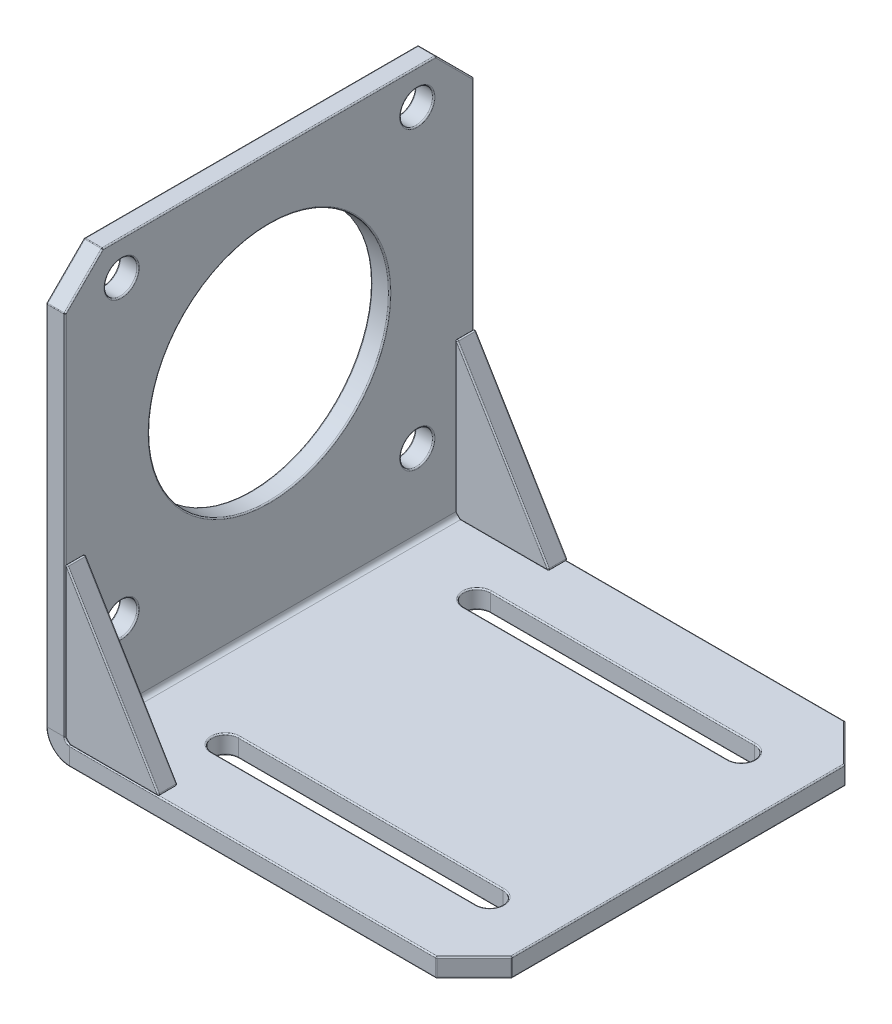
from build123d import *

# Parameters (mm, degrees)
SCHIZZO1_W                     = 68
SCHIZZO1_H                     = 3
BASE_FLANGIA1_DEPTH            = 32.5
BORDO_FLANGIA1_STRIP_W         = 13.4732
BORDO_FLANGIA1_STRIP_H         = 3
BORDO_FLANGIA1_STRIP_CUT_DEPTH = 65
BORDO_FLANGIA1_DEPTH           = 65
SCHIZZO10_R                    = 19.1
SCHIZZO10_R_2                  = 2.6
TAGLIO_ESTRUSIONE1_DEPTH       = 98.5
TAGLIO_ESTRUSIONE3_DEPTH       = 100.525122457
ESTRUSIONE_ESTRUSIONE3_START   = 32.5
ESTRUSIONE_ESTRUSIONE3_DEPTH   = 3
SMUSSO1_SIZE                   = 6
RACCORDO1_R                    = 0.2
RACCORDO2_R                    = 0.2
RACCORDO3_R                    = 0.2


# Sheet-metal steps are written as plain solids
with BuildPart() as part:
    # Schizzo1 → Base-Flangia1 (new, symmetric)
    with BuildSketch(Plane.XY):
        with Locations((34, -1.5)):
            Rectangle(SCHIZZO1_W, SCHIZZO1_H)
    extrude(amount=BASE_FLANGIA1_DEPTH, both=True)

    # Bordo-Flangia1 strip (across the edge) → Bordo-Flangia1 strip cut (cut)
    with BuildSketch(Plane.XY.offset(-32.5)):
        with Locations((-3, -1.5)):
            Rectangle(BORDO_FLANGIA1_STRIP_W, BORDO_FLANGIA1_STRIP_H)
    extrude(amount=BORDO_FLANGIA1_STRIP_CUT_DEPTH, mode=Mode.SUBTRACT)

    # Bordo-Flangia1 section (across the edge) → Bordo-Flangia1 (add)
    with BuildSketch(Plane.XY.offset(-32.5)):
        with BuildLine():
            Line((0, 0.7366), (0, 65))
            Line((0, 65), (3, 65))
            Line((3, 65), (3, 0.7366))
            ThreePointArc((3, 0.7366), (3.215745145, 0.215745145), (3.7366, 0))
            Line((3.7366, 0), (3.7366, -3))
            ThreePointArc((3.7366, -3), (1.094424801, -1.905575199), (0, 0.7366))
        make_face()
    extrude(amount=BORDO_FLANGIA1_DEPTH)

    # Schizzo10 → Taglio-Estrusione1 (cut, through all)
    with BuildSketch(Plane(origin=(3, 0, 0), x_dir=(0, 0, -1), z_dir=(1, 0, 0))):
        with Locations(Location((0, 36, 0), (0, 0, 90))):
            Circle(SCHIZZO10_R)
        with Locations(Location((-23.5, 59.5, 0), (0, 0, 90))):
            Circle(SCHIZZO10_R_2)
        with Locations(Location((23.5, 59.5, 0), (0, 0, 270))):
            Circle(SCHIZZO10_R_2)
        with Locations(Location((-23.5, 12.5, 0), (0, 0, 270))):
            Circle(SCHIZZO10_R_2)
        with Locations(Location((23.5, 12.5, 0), (0, 0, 90))):
            Circle(SCHIZZO10_R_2)
    extrude(amount=-TAGLIO_ESTRUSIONE1_DEPTH, mode=Mode.SUBTRACT)

    # Schizzo12 → Taglio-Estrusione3 (cut, through all)
    with BuildSketch(Plane(origin=(0, 0, 0), x_dir=(1, 0, 0), z_dir=(0, 1, 0))):
        with BuildLine():
            Line((58, 17.9), (16, 17.9))
            ThreePointArc((16, 17.9), (13.9, 20), (16, 22.1))
            Line((16, 22.1), (58, 22.1))
            ThreePointArc((58, 22.1), (60.1, 20), (58, 17.9))
        make_face()
        with BuildLine():
            Line((58, -22.1), (16, -22.1))
            ThreePointArc((16, -22.1), (13.9, -20), (16, -17.9))
            Line((16, -17.9), (58, -17.9))
            ThreePointArc((58, -17.9), (60.1, -20), (58, -22.1))
        make_face()
    extrude(amount=-TAGLIO_ESTRUSIONE3_DEPTH, mode=Mode.SUBTRACT)

    # Smusso1
    smusso1_edges = [part.edges().sort_by_distance(p)[0] for p in [
        (1.5, 65, -32.5),
        (1.5, 65, 32.5),
        (68, -1.5, -32.5),
        (68, -1.5, 32.5),
    ]]
    chamfer(smusso1_edges, length=SMUSSO1_SIZE)

    # Raccordo1
    raccordo1_edges = [part.edges().sort_by_distance(p)[0] for p in [
        (68, 0, 0),
        (68, -3, 0),
        (68, -1.5, -26.5),
        (68, -1.5, 26.5),
        (65, -3, -29.5),
        (65, -3, 29.5),
        (62, -1.5, 32.5),
        (65, 0, -29.5),
        (65, 0, 29.5),
        (62, -1.5, -32.5),
        (0, 29.8683, -32.5),
        (3, 29.8683, -32.5),
        (1.5, 59, -32.5),
        (3, 65, 0),
        (3, 62, 29.5),
        (3, 62, -29.5),
        (32.8683, -3, -32.5),
        (0, 65, 0),
        (1.5, 65, 26.5),
        (1.5, 65, -26.5),
        (0, 62, 29.5),
        (32.8683, 0, -32.5),
        (0, 62, -29.5),
        (1.5, 59, 32.5),
        (32.8683, -3, 32.5),
        (32.8683, 0, 32.5),
        (1.094424801, -1.905575199, -32.5),
        (1.094424801, -1.905575199, 32.5),
        (3.215745145, 0.215745145, -32.5),
        (3.215745145, 0.215745145, 32.5),
        (3, 29.8683, 32.5),
        (0, 29.8683, 32.5),
        (0, 9.9, -23.5),
        (3, 9.9, -23.5),
        (0, 15.1, 23.5),
        (3, 15.1, 23.5),
        (0, 62.1, -23.5),
        (3, 62.1, -23.5),
        (0, 56.9, 23.5),
        (3, 56.9, 23.5),
        (0, 16.9, 0),
        (3, 16.9, 0),
        (60.1, -3, -20),
        (37, -3, -17.9),
        (13.9, -3, -20),
        (37, -3, -22.1),
        (60.1, 0, -20),
        (37, 0, -22.1),
        (13.9, 0, -20),
        (37, 0, -17.9),
        (60.1, -3, 20),
        (37, -3, 22.1),
        (13.9, -3, 20),
        (37, -3, 17.9),
        (60.1, 0, 20),
        (37, 0, 17.9),
        (13.9, 0, 20),
        (37, 0, 22.1),
    ]]
    fillet(raccordo1_edges, radius=RACCORDO1_R)


with BuildPart() as body_2:
    # Schizzo15 → Estrusione-Estrusione3 (new body)
    with BuildSketch(Plane.XY.offset(ESTRUSIONE_ESTRUSIONE3_START)):
        Polygon((3, 25), (18, 0), (3.7366, 0), (3, 0.7366), align=None)
    extrude(amount=-ESTRUSIONE_ESTRUSIONE3_DEPTH)


with BuildPart() as body_3:
    # Specchia5: mirrored copy
    add(body_2.part.mirror(Plane.XY))

    # Raccordo2
    raccordo2_edges = [body_3.edges().sort_by_distance(p)[0] for p in [
        (3, 12.8683, -29.5),
        (3.3683, 0.3683, -29.5),
        (10.8683, 0, -29.5),
        (3.3683, 0.3683, -32.5),
        (3, 12.8683, -32.5),
        (10.5, 12.5, -32.5),
        (10.8683, 0, -32.5),
        (10.5, 12.5, -29.5),
        (3, 25, -31),
        (18, 0, -31),
    ]]
    fillet(raccordo2_edges, radius=RACCORDO2_R)


with BuildPart() as body_2_1:
    add(body_2.part)

    # Raccordo3
    raccordo3_edges = [body_2_1.edges().sort_by_distance(p)[0] for p in [
        (3, 12.8683, 29.5),
        (3.3683, 0.3683, 29.5),
        (10.8683, 0, 29.5),
        (3.3683, 0.3683, 32.5),
        (3, 12.8683, 32.5),
        (10.5, 12.5, 32.5),
        (10.8683, 0, 32.5),
        (10.5, 12.5, 29.5),
        (3, 25, 31),
        (18, 0, 31),
    ]]
    fillet(raccordo3_edges, radius=RACCORDO3_R)


solid = Compound([part.part, body_3.part, body_2_1.part])
